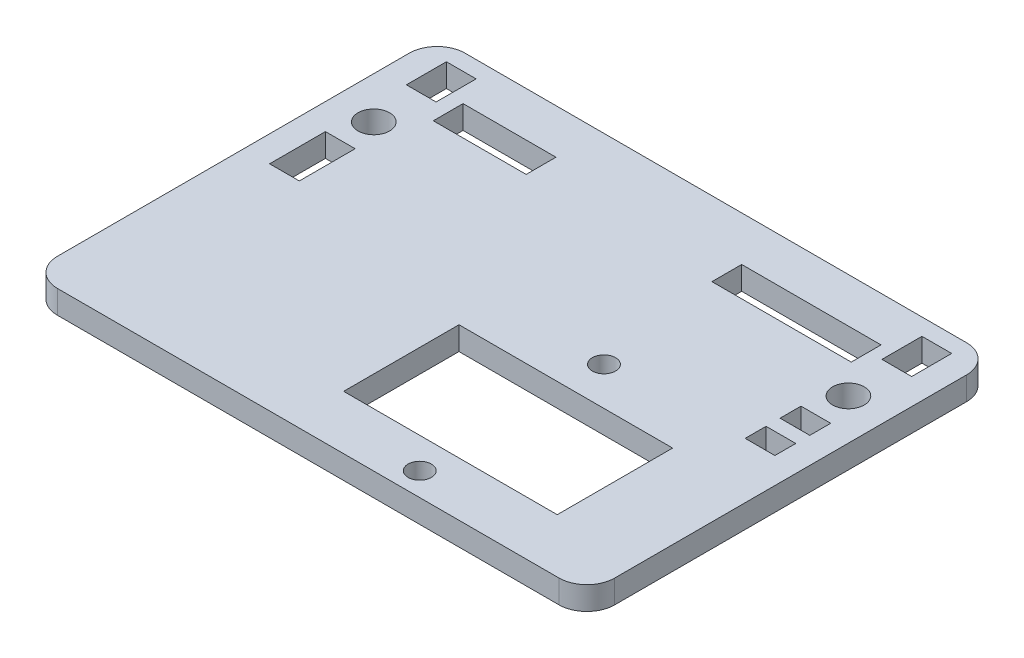
from build123d import *

# Parameters (mm, degrees)
SKETCH1_R           = 1.7
SKETCH1_R_2         = 1.25
SKETCH1_W           = 3.194434014
SKETCH1_H           = 2.247005984
SKETCH1_W_2         = 3.194258538
SKETCH1_H_2         = 6.00021965
SKETCH1_W_3         = 14.9734805
SKETCH1_H_3         = 3.200030878
SKETCH1_W_4         = 9.982157856
SKETCH1_W_5         = 3.194239042
SKETCH1_H_4         = 4.3002681
SKETCH1_H_5         = 2.247064582
SKETCH1_H_6         = 4.300268101
SKETCH1_W_6         = 22.959156093
SKETCH1_H_7         = 12.400537771
BOSS_EXTRUDE1_DEPTH = 2.5


with BuildPart() as part:
    # Sketch1 → Boss-Extrude1 (new body)
    with BuildSketch(Plane(origin=(0, 0, 0), x_dir=(1, 0, 0), z_dir=(0, 1, 0))):
        with BuildLine():
            Line((-8.89863563, 14.616816531), (-8.898772113, -23.184447467))
            ThreePointArc((-8.898772113, -23.184447467), (-8.020049515, -25.305871479), (-5.898625504, -26.184594076))
            Line((-5.898625504, -26.184594076), (48.00009504, -26.184594076))
            ThreePointArc((48.00009504, -26.184594076), (50.117687721, -25.307458468), (50.994823329, -23.189865787))
            Line((50.994823329, -23.189865787), (50.994823329, 14.616811748))
            ThreePointArc((50.994823329, 14.616811748), (50.116118686, 16.738192414), (47.99473802, 17.616897057))
            Line((47.99473802, 17.616897057), (-5.904126705, 17.616897057))
            ThreePointArc((-5.904126705, 17.616897057), (-8.023535046, 16.737855239), (-8.89863563, 14.616816531))
        make_face()
        with Locations((-4.406755257, 6.316598951)):
            Circle(SKETCH1_R, mode=Mode.SUBTRACT)
        with Locations((30.531216432, -3.884174874)):
            Circle(SKETCH1_R_2, mode=Mode.SUBTRACT)
        with Locations((46.602725133, 6.316403622)):
            Circle(SKETCH1_R, mode=Mode.SUBTRACT)
        with Locations((30.531216431, -23.684709277)):
            Circle(SKETCH1_R_2, mode=Mode.SUBTRACT)
        with Locations((46.602666641, -2.060335363)):
            Rectangle(SKETCH1_W, SKETCH1_H, mode=Mode.SUBTRACT)
        with Locations((-4.506903026, -0.183533202)):
            Rectangle(SKETCH1_W_2, SKETCH1_H_2, mode=Mode.SUBTRACT)
        with Locations((36.121280984, 11.216808443)):
            Rectangle(SKETCH1_W_3, SKETCH1_H_3, mode=Mode.SUBTRACT)
        with Locations((3.678834136, 11.216808444)):
            Rectangle(SKETCH1_W_4, SKETCH1_H_3, mode=Mode.SUBTRACT)
        with Locations((-4.506717801, 13.66683384)):
            Rectangle(SKETCH1_W_5, SKETCH1_H_4, mode=Mode.SUBTRACT)
        with Locations((46.602666641, 1.692917368)):
            Rectangle(SKETCH1_W, SKETCH1_H_5, mode=Mode.SUBTRACT)
        with Locations((46.602666642, 13.666833838)):
            Rectangle(SKETCH1_W, SKETCH1_H_6, mode=Mode.SUBTRACT)
        with Locations((30.531148191, -14.184180414)):
            Rectangle(SKETCH1_W_6, SKETCH1_H_7, mode=Mode.SUBTRACT)
    extrude(amount=BOSS_EXTRUDE1_DEPTH)


solid = part.part
